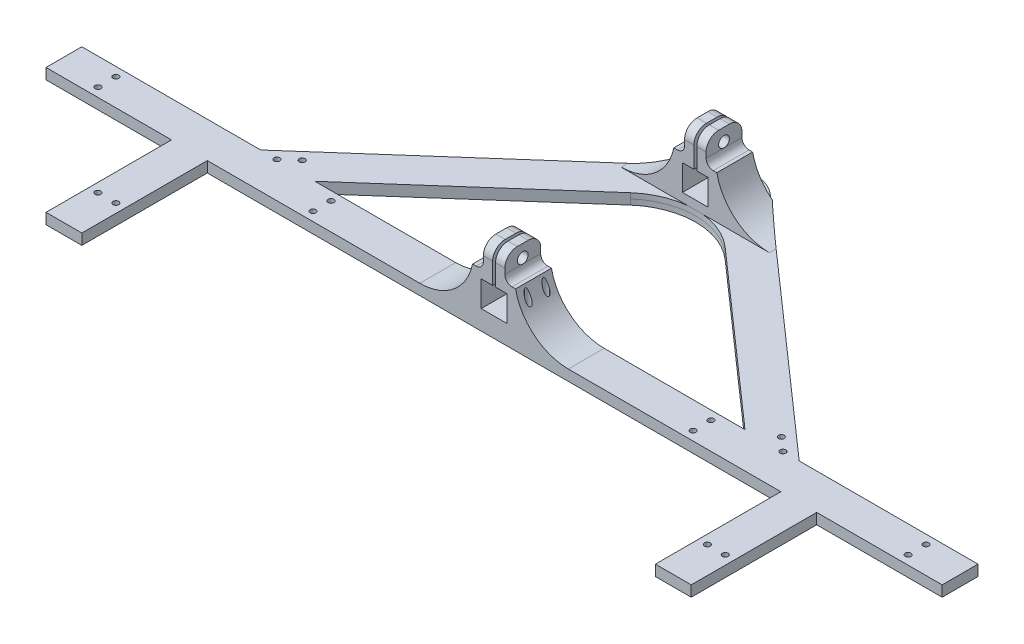
from build123d import *

# Parameters (mm, degrees)
EXTRUDE_1_DEPTH      = 1.5
EXTRUDE_10_DEPTH     = 1.5
FILLET_1_R           = 10
FILLET_2_R           = 20
EXTRUDE_11_DEPTH     = 20
EXTRUDE_13_DEPTH     = 35
EXTRUDE_14_DEPTH     = 35
EXTRUDE_15_DEPTH     = 1.5
FILLET_5_R           = 20
FILLET_6_R           = 10
SKETCH_58_R          = 0.8000000000000042
SKETCH_58_R_2        = 0.8000000000000055
SKETCH_58_R_3        = 0.8000000000000044
SKETCH_58_R_4        = 0.7999999999999963
SKETCH_58_R_5        = 0.8000000000000119
SKETCH_58_R_6        = 0.7999999999999946
SKETCH_58_R_7        = 0.7999999999999954
SKETCH_58_R_8        = 0.7999999999999948
SKETCH_58_R_9        = 0.8000000000000026
CUT_EXTRUDE_52_DEPTH = 145.10569310974057
SKETCH_26_W          = 22
SKETCH_26_H          = 10
EXTRUDE_16_DEPTH     = 20
CUT_EXTRUDE_53_DEPTH = 163.22491745731594
FILLET_7_R           = 15
FILLET_8_R           = 15
FILLET_9_R           = 3.5
SKETCH_60_R          = 1.5000000000000042
CUT_EXTRUDE_54_DEPTH = 147.3444593643323
SKETCH_61_R          = 1.5000000000000004
CUT_EXTRUDE_55_DEPTH = 147.3444593643323
FILLET_10_R          = 2
SKETCH_63_R          = 0.7999999999999954
CUT_EXTRUDE_56_DEPTH = 144.52160390212592
CUT_EXTRUDE_57_DEPTH = 147.15693979025303


# Some blends are built 0.0001 mm under size
with BuildPart() as part:
    # 草图1 → 凸台-拉伸1 (new body)
    with BuildSketch(Plane(origin=(0, 0, 0), x_dir=(1, 0, 0), z_dir=(0, 1, 0))):
        Polygon((-125, 4.999999999999984), (124.99999999999996, 4.999999999999984), (124.99999999999996, -5.0000000000000115), (-125.00000000000003, -5.0000000000000115), align=None)
    extrude(amount=EXTRUDE_1_DEPTH)



with BuildPart() as body_2:
    # 草图22 → 凸台-拉伸10 (new body)
    with BuildSketch(Plane.XZ):
        Polygon((-3.09e-14, -71.24835955462486), (-3.362e-14, -57.91502622129154), (-60.00000000000021, -4.9999999999999805), (-75.11857892036937, -4.9999999999999805), align=None)
        Polygon((60.00000000000021, -4.9999999999999645), (1.388e-14, -57.91502622129154), (-3.09e-14, -71.24835955462486), (75.1185789203694, -4.999999999999957), align=None)
    extrude(amount=-EXTRUDE_10_DEPTH)

    # 圆角1
    fillet_1_edges = [body_2.edges().sort_by_distance(p)[0] for p in [
        (-8.35e-15, 0.75, -71.24835955462484),
    ]]
    fillet(fillet_1_edges, radius=FILLET_1_R)

    # 圆角2
    fillet_2_edges = [body_2.edges().sort_by_distance(p)[0] for p in [
        (-9.71e-15, 0.75, -57.91502622129154),
    ]]
    fillet(fillet_2_edges, radius=FILLET_2_R)


with BuildPart() as part_1:
    add(part.part)

    add(body_2.part)  # 凸台-拉伸11 merges body 2
    # 草图24 → 凸台-拉伸11 (add)
    with BuildSketch(Plane(origin=(0, 1.5, 0), x_dir=(1, 0, 0), z_dir=(0, 1, 0))):
        Polygon((-10.000000000000004, 4.999999999999999), (9.999999999999996, 4.999999999999999), (9.999999999999996, -5.000000000000001), (-10.000000000000002, -5.000000000000001), align=None)
    extrude(amount=EXTRUDE_11_DEPTH)

    # 草图41 → 凸台-拉伸13 (add)
    with BuildSketch(Plane.XY.offset(5.0000000000000115)):
        Polygon((89.99999999999996, 1.4999999999999951), (79.99999999999996, 1.4999999999999951), (79.99999999999996, -4.88e-15), (89.99999999999996, -4.99e-15), (89.99999999999996, 0.7499999999999958), align=None)
    extrude(amount=EXTRUDE_13_DEPTH)

    # 草图42 → 凸台-拉伸14 (add)
    with BuildSketch(Plane.XY.offset(5.0000000000000115)):
        Polygon((-80, 1.4999999999999998), (-90, 1.4999999999999998), (-90, 0.75), (-90, -2.2e-16), (-80, -2.2e-16), align=None)
    extrude(amount=EXTRUDE_14_DEPTH)

    # 草图57 → 凸台-拉伸15 (add)
    with BuildSketch(Plane(origin=(0, 0, 0), x_dir=(-1, 0, 0), z_dir=(0, -1, 0))):
        Polygon((125.00000000000003, -5.0000000000000115), (90, -5.0000000000000115), (90, -40.000000000000014), (80, -40.000000000000014), (80, -5.0000000000000115), (-79.99999999999996, -5.0000000000000115), (-79.99999999999996, -40.000000000000014), (-89.99999999999996, -40.000000000000014), (-89.99999999999994, -5.0000000000000115), (-124.99999999999996, -5.0000000000000115), (-124.99999999999996, 4.999999999999984), (-75.11857892036936, 4.999999999999984), (-6.614378277661482, 65.41502622129155), (-3.024e-14, 71.24835955462483), (6.614378277661415, 65.41502622129157), (75.11857892036936, 4.999999999999984), (125, 4.999999999999984), align=None)
        Polygon((60.00000000000022, 4.999999999999984), (-60.00000000000011, 4.999999999999984), (-2.082e-14, 57.915026221291534), align=None, mode=Mode.SUBTRACT)
    extrude(amount=EXTRUDE_15_DEPTH)

    # 圆角5
    fillet_5_edges = [part_1.edges().sort_by_distance(p)[0] for p in [
        (2.082e-14, -0.75, -57.915026221291534),
    ]]
    fillet(fillet_5_edges, radius=FILLET_5_R)

    # 圆角6
    fillet_6_edges = [part_1.edges().sort_by_distance(p)[0] for p in [
        (3.024e-14, -0.75, -71.24835955462483),
    ]]
    fillet(fillet_6_edges, radius=FILLET_6_R)

    # 草图58 → 切除-拉伸52 (cut, through all)
    with BuildSketch(Plane.XZ.offset(1.5)):
        with Locations(Location((7, 2.499999999999986, 0), (0, 0, 270))):
            Circle(SKETCH_58_R)
        with Locations(Location((6.999999999999998, -2.5000000000000147, 0), (0, 0, 270))):
            Circle(SKETCH_58_R_2)
        with Locations(Location((53, 2.5000000000000027, 0), (0, 0, 270))):
            Circle(SKETCH_58_R_3)
        with Locations(Location((53.000000000000014, -2.5000000000000027, 0), (0, 0, 270))):
            Circle(SKETCH_58_R_4)
        with Locations(Location((112.99999999999994, 2.5000000000000138, 0), (0, 0, 270))):
            Circle(SKETCH_58_R_5)
        with Locations(Location((112.99999999999997, -2.500000000000007, 0), (0, 0, 270))):
            Circle(SKETCH_58_R_6)
        with Locations(Location((-87.5, 28.000000000000014, 0), (0, 0, 270))):
            Circle(SKETCH_58_R_7)
        with Locations(Location((-82.49999999999999, 28.000000000000007, 0), (0, 0, 270))):
            Circle(SKETCH_58_R_8)
        with Locations(Location((-112.99999999999996, -2.5, 0), (0, 0, 270))):
            Circle(SKETCH_58_R_7)
        with Locations(Location((-112.99999999999996, 2.4999999999999987, 0), (0, 0, 270))):
            Circle(SKETCH_58_R_7)
        with Locations(Location((-53, -2.5, 0), (0, 0, 270))):
            Circle(SKETCH_58_R_9)
        with Locations(Location((-53, 2.5, 0), (0, 0, 270))):
            Circle(SKETCH_58_R_9)
        with Locations(Location((82.49999999999999, 28.000000000000036, 0), (0, 0, 270))):
            Circle(SKETCH_58_R_7)
        with Locations(Location((87.5, 28.000000000000036, 0), (0, 0, 270))):
            Circle(SKETCH_58_R_7)
    extrude(amount=-CUT_EXTRUDE_52_DEPTH, mode=Mode.SUBTRACT)

    # 草图26 → 凸台-拉伸16 (add)
    with BuildSketch(Plane(origin=(0, 1.5, 0), x_dir=(1, 0, 0), z_dir=(0, 1, 0))):
        with Locations((-1.78e-15, 56.141850111775966)):
            Rectangle(SKETCH_26_W, SKETCH_26_H)
    extrude(amount=EXTRUDE_16_DEPTH)

    # 草图59 → 切除-拉伸53 (cut, through all)
    with BuildSketch(Plane(origin=(1.928e-14, 0, -61.14185011177596), x_dir=(-1, 0, -3.2e-16), z_dir=(3.2e-16, 0, -1))):
        Polygon((5.999999999999998, 13.5), (5.999999999999998, 1.5), (11.000000000000021, 1.5), (11.00000000000002, 21.5), (-10.99999999999998, 21.5), (-10.999999999999979, 1.5), (-6, 1.5), (-6.000000000000002, 13.499999999999996), (-3.0000000000000018, 13.499999999999996), (-3.0000000000000018, 20.499999999999996), (-0.40000000000000174, 20.499999999999996), (-1.73e-15, 20.499999999999996), (0.3999999999999983, 20.499999999999996), (2.9999999999999982, 20.499999999999996), (2.9999999999999982, 13.499999999999996), align=None)
        Polygon((-3.5000000000000013, 4.037645071572423), (-1.78e-15, 4.037645071572423), (3.4999999999999982, 4.037645071572423), (3.4999999999999982, 11.037645071572424), (0.927810105733712, 11.037645071572424), (0.3999999999999977, 11.037645071572424), (-1.78e-15, 11.037645071572424), (-0.4000000000000017, 11.037645071572422), (-3.5000000000000018, 11.037645071572422), align=None)
        Polygon((-0.4000000000000018, 13.499999999999996), (-0.4000000000000018, 11.037645071572424), (-1.78e-15, 11.037645071572424), (0.3999999999999977, 11.037645071572424), (0.3999999999999976, 13.499999999999996), (-1.78e-15, 13.499999999999998), align=None)
        Polygon((-0.40000000000000174, 20.499999999999996), (-0.4000000000000018, 13.499999999999996), (-1.78e-15, 13.499999999999998), (-1.73e-15, 20.499999999999996), align=None)
        Polygon((-1.78e-15, 13.499999999999998), (0.3999999999999977, 13.499999999999998), (0.3999999999999983, 20.499999999999996), (-1.73e-15, 20.499999999999996), align=None)
    extrude(amount=-CUT_EXTRUDE_53_DEPTH, mode=Mode.SUBTRACT)

    # 圆角7
    # the kernel refuses this fillet: 15 mm, written as the material it adds along each edge
    with BuildSketch(Plane(origin=(6.0000000000000195, 1.5, -61.14185011177596), x_dir=(1, 0, 3.2e-16), z_dir=(-3.2e-16, 0, 1))) as fillet_7_piece_1_section:
        with BuildLine():
            CenterArc((14.696938456699067, 15), FILLET_7_R, 191.5369590328155, 78.4630409671845)
            Line((1.78e-15, 11.999999999999996), (0, 0))
            Line((0, 0), (14.696938456699067, 0))
        make_face()
    fillet_7_piece_1 = extrude(amount=9.999999999999993, mode=Mode.PRIVATE)
    fillet_7_piece_1 = split(fillet_7_piece_1, bisect_by=Plane(origin=(8.388620739132056, 1.5, -63.85029144843083), z_dir=(-0.6614378277661448, 0, 0.7500000000000027)), keep=Keep.TOP, mode=Mode.PRIVATE)
    add(fillet_7_piece_1)
    with BuildSketch(Plane(origin=(-5.99999999999998, 1.5, -61.14185011177596), x_dir=(-1, 0, -3.2e-16), z_dir=(-3.2e-16, 0, 1))) as fillet_7_piece_2_section:
        with BuildLine():
            CenterArc((14.696938456699073, -15), FILLET_7_R, 90, 78.46304096718453)
            Line((8.9e-16, -12), (0, 0))
            Line((0, 0), (14.696938456699073, 0))
        make_face()
    fillet_7_piece_2 = extrude(amount=9.999999999999993, mode=Mode.PRIVATE)
    fillet_7_piece_2 = split(fillet_7_piece_2, bisect_by=Plane(origin=(-8.388620739132019, 1.5, -63.85029144843084), z_dir=(0.6614378277661446, 0, 0.7500000000000028)), keep=Keep.TOP, mode=Mode.PRIVATE)
    add(fillet_7_piece_2)

    # 圆角8
    # the kernel refuses this fillet: 15 mm, written as the material it adds along each edge
    with BuildSketch(Plane(origin=(6.000000000000002, 1.5, -4.999999999999986), x_dir=(1, 0, 3.2e-16), z_dir=(-3.2e-16, 0, 1))) as fillet_8_piece_1_section:
        with BuildLine():
            CenterArc((14.69693845669907, 15), FILLET_8_R, 191.5369590328155, 78.4630409671845)
            Line((1.78e-15, 11.999999999999996), (0, 0))
            Line((0, 0), (14.69693845669907, 0))
        make_face()
    fillet_8_piece_1 = extrude(amount=9.999999999999993, mode=Mode.PRIVATE)
    fillet_8_piece_1 = fillet_8_piece_1 - Plane(origin=(6.999999999999998, 1.5, -2.5000000000000147), x_dir=(-1.8e-16, 0, -1), z_dir=(0, -1, 0)) * Cylinder(0.8000000000000055, 79, mode=Mode.PRIVATE)
    fillet_8_piece_1 = fillet_8_piece_1 - Plane(origin=(7, 1.5, 2.499999999999986), x_dir=(-1.8e-16, 0, -1), z_dir=(0, -1, 0)) * Cylinder(0.8000000000000042, 79, mode=Mode.PRIVATE)
    add(fillet_8_piece_1)
    with BuildSketch(Plane(origin=(-5.999999999999997, 1.5, -4.999999999999986), x_dir=(-1, 0, -3.2e-16), z_dir=(-3.2e-16, 0, 1))) as fillet_8_piece_2:
        with BuildLine():
            CenterArc((14.696938456699069, -15), FILLET_8_R, 90, 78.4630409671845)
            Line((8.9e-16, -12), (0, 0))
            Line((0, 0), (14.696938456699069, 0))
        make_face()
    extrude(amount=9.999999999999993)

    # 圆角9
    fillet_9_edges = [part_1.edges().sort_by_distance(p)[0] for p in [
        (-1.6999999999999824, 20.499999999999996, -51.141850111775966),
        (1.700000000000018, 20.499999999999996, -51.141850111775966),
        (1.7000000000000028, 20.499999999999996, 5.000000000000009),
        (1.700000000000021, 20.499999999999996, -61.14185011177596),
        (-1.7000000000000028, 20.499999999999996, 5.000000000000009),
        (-1.699999999999979, 20.499999999999996, -61.14185011177596),
        (1.70000000000001, 20.499999999999996, -4.999999999999985),
        (-1.6999999999999957, 20.499999999999996, -4.999999999999985),
    ]]
    fillet(fillet_9_edges, radius=FILLET_9_R)

    # 草图60 → 切除-拉伸54 (cut, through all)
    with BuildSketch(Plane.ZY.offset(2.9999999999999987)):
        with Locations((-56.14185011177597, 16.999999999999996)):
            Circle(SKETCH_60_R)
    extrude(amount=-CUT_EXTRUDE_54_DEPTH, mode=Mode.SUBTRACT)

    # 草图61 → 切除-拉伸55 (cut, through all)
    with BuildSketch(Plane.ZY.offset(2.9999999999999987)):
        with Locations((4.3e-16, 16.999999999999996)):
            Circle(SKETCH_61_R)
    extrude(amount=-CUT_EXTRUDE_55_DEPTH, mode=Mode.SUBTRACT)

    # 圆角10
    fillet_10_edges = [part_1.edges().sort_by_distance(p)[0] for p in [
        (3.0000000000000018, 13.499999999999996, 7.11e-15),
        (3.000000000000019, 13.499999999999996, -56.141850111775966),
        (-2.9999999999999982, 13.499999999999998, 7.11e-15),
        (-2.999999999999981, 13.499999999999998, -56.141850111775966),
    ]]
    fillet(fillet_10_edges, radius=FILLET_10_R - 0.0001)  # a hair under: the kernel refuses the full size

    # 草图63 → 切除-拉伸56 (cut, through all)
    with BuildSketch(Plane(origin=(0, 1.5, 0), x_dir=(1, 0, 0), z_dir=(0, 1, 0))):
        with Locations(Location((70.5830052442586, 4.999999999999985, 0), (0, 0, 270))):
            Circle(SKETCH_63_R)
        with Locations(Location((66.83300524425859, 8.307189138830706, 0), (0, 0, 270))):
            Circle(SKETCH_63_R)
        with Locations(Location((-66.83300524425859, 8.307189138830706, 0), (0, 0, 270))):
            Circle(SKETCH_63_R)
        with Locations(Location((-70.5830052442586, 4.999999999999985, 0), (0, 0, 270))):
            Circle(SKETCH_63_R)
    extrude(amount=-CUT_EXTRUDE_56_DEPTH, mode=Mode.SUBTRACT)

    # 草图64 → 切除-拉伸57 (cut, through all)
    with BuildSketch(Plane.XY.offset(5.0000000000000115)):
        Polygon((-3.5000000000000004, 11.037645071572424), (3.4999999999999996, 11.037645071572424), (3.599999999999999, 11.037645071572424), (3.599999999999999, 11.137645071572424), (-3.5000000000000004, 11.137645071572424), align=None)
        Polygon((3.599999999999999, 11.037645071572424), (3.4999999999999996, 11.037645071572424), (3.5000000000000004, 4.037645071572423), (3.5000000000000004, 3.9376450715724243), (3.6, 3.9376450715724243), align=None)
        Polygon((3.5000000000000004, 4.037645071572423), (3.4999999999999996, 11.037645071572424), (-3.5000000000000004, 11.037645071572424), (-3.5000000000000004, 4.037645071572423), align=None)
        Polygon((3.5000000000000004, 3.9376450715724243), (3.5000000000000004, 4.037645071572423), (-3.500000000000001, 4.037645071572422), (-3.6000000000000005, 4.037645071572422), (-3.6000000000000005, 3.9376450715724234), align=None)
        Polygon((-3.5000000000000004, 4.037645071572423), (-3.5000000000000004, 11.037645071572424), (-3.5000000000000004, 11.137645071572424), (-3.6000000000000005, 11.137645071572424), (-3.6000000000000005, 4.037645071572422), align=None)
    extrude(amount=-CUT_EXTRUDE_57_DEPTH, mode=Mode.SUBTRACT)


solid = part_1.part
